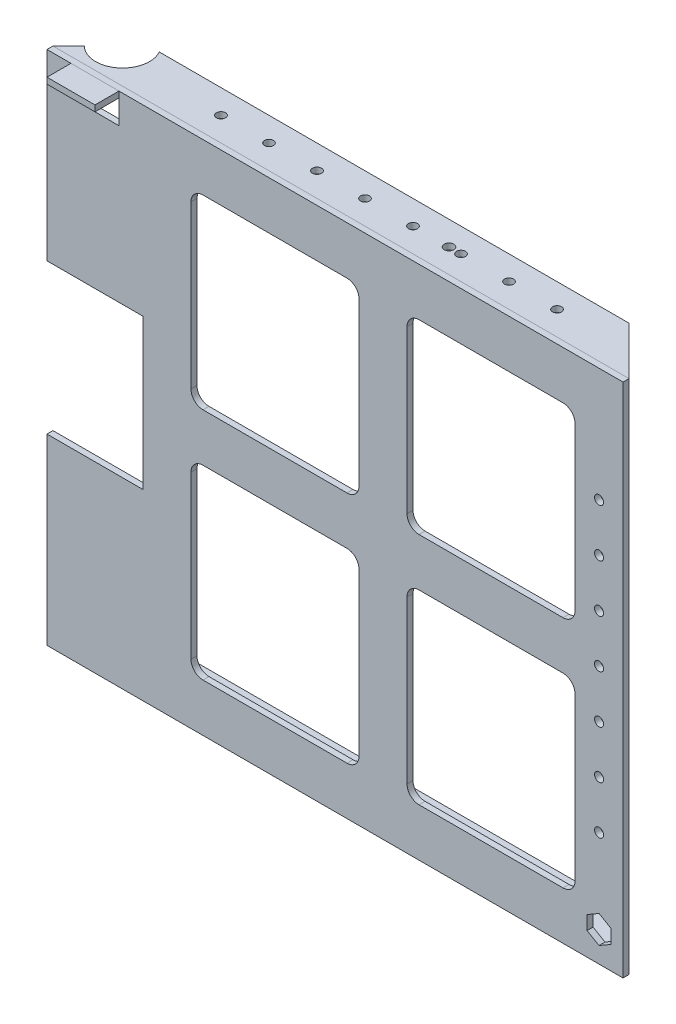
from build123d import *

# Parameters (mm, degrees)
SKETCH1_W           = 304.8
SKETCH1_H           = 273.05
BOSS_EXTRUDE1_DEPTH = 3.175
SKETCH2_W           = 50.8
SKETCH2_H           = 79.375
CUT_EXTRUDE1_DEPTH  = 3.175
SKETCH4_W           = 304.8
SKETCH4_H           = 3.175
BASE_FLANGE1_DEPTH  = 25.4
SKETCH9_W           = 304.8
SKETCH9_H           = 3.175
BASE_FLANGE2_DEPTH  = 25.4
SKETCH12_W          = 25.4
SKETCH12_H          = 3.175
BASE_FLANGE3_DEPTH  = 12.7
CHAMFER1_SIZE       = 25.4
CHAMFER2_SIZE       = 25.4
SKETCH16_W          = 25.4
SKETCH16_H          = 12.7
CUT_EXTRUDE4_DEPTH  = 3.175
SKETCH17_R          = 2.38125
CUT_EXTRUDE5_DEPTH  = 411.005490817
SKETCH18_R          = 2.38125
CUT_EXTRUDE6_DEPTH  = 411.214423351
SKETCH19_R          = 14.2875
CUT_EXTRUDE7_DEPTH  = 3.175
SKETCH20_R          = 14.2875
CUT_EXTRUDE8_DEPTH  = 3.175
SKETCH21_R          = 2.5527
CUT_EXTRUDE9_DEPTH  = 411.005490817
CUT_EXTRUDE10_DEPTH = 411.214423351


# Sheet-metal steps are written as plain solids
with BuildPart() as part:
    # Sketch1 → Boss-Extrude1 (new body)
    with BuildSketch(Plane.XY):
        with Locations((152.4, 136.525)):
            Rectangle(SKETCH1_W, SKETCH1_H)
    extrude(amount=BOSS_EXTRUDE1_DEPTH)

    # Sketch2 → Cut-Extrude1 (cut)
    with BuildSketch(Plane.XY.offset(3.175)):
        with Locations((25.4, 136.525)):
            Rectangle(SKETCH2_W, SKETCH2_H)
        with BuildLine():
            Line((82.55, 247.65), (158.75, 247.65))
            ThreePointArc((158.75, 247.65), (163.240128061, 245.790128061), (165.1, 241.3))
            Line((165.1, 241.3), (165.1, 155.575))
            ThreePointArc((165.1, 155.575), (163.240128061, 151.084871939), (158.75, 149.225))
            Line((158.75, 149.225), (82.55, 149.225))
            ThreePointArc((82.55, 149.225), (78.059871939, 151.084871939), (76.2, 155.575))
            Line((76.2, 155.575), (76.2, 241.3))
            ThreePointArc((76.2, 241.3), (78.059871939, 245.790128061), (82.55, 247.65))
        make_face()
        with BuildLine():
            Line((279.4, 241.3), (279.4, 155.575))
            ThreePointArc((279.4, 155.575), (277.540128061, 151.084871939), (273.05, 149.225))
            Line((273.05, 149.225), (196.85, 149.225))
            ThreePointArc((196.85, 149.225), (192.359871939, 151.084871939), (190.5, 155.575))
            Line((190.5, 155.575), (190.5, 241.3))
            ThreePointArc((190.5, 241.3), (192.359871939, 245.790128061), (196.85, 247.65))
            Line((196.85, 247.65), (273.05, 247.65))
            ThreePointArc((273.05, 247.65), (277.540128061, 245.790128061), (279.4, 241.3))
        make_face()
        with BuildLine():
            Line((82.55, 123.825), (158.75, 123.825))
            ThreePointArc((158.75, 123.825), (163.240128061, 121.965128061), (165.1, 117.475))
            Line((165.1, 117.475), (165.1, 31.75))
            ThreePointArc((165.1, 31.75), (163.240128061, 27.259871939), (158.75, 25.4))
            Line((158.75, 25.4), (82.55, 25.4))
            ThreePointArc((82.55, 25.4), (78.059871939, 27.259871939), (76.2, 31.75))
            Line((76.2, 31.75), (76.2, 117.475))
            ThreePointArc((76.2, 117.475), (78.059871939, 121.965128061), (82.55, 123.825))
        make_face()
        with BuildLine():
            Line((279.4, 117.475), (279.4, 31.75))
            ThreePointArc((279.4, 31.75), (277.540128061, 27.259871939), (273.05, 25.4))
            Line((273.05, 25.4), (196.85, 25.4))
            ThreePointArc((196.85, 25.4), (192.359871939, 27.259871939), (190.5, 31.75))
            Line((190.5, 31.75), (190.5, 117.475))
            ThreePointArc((190.5, 117.475), (192.359871939, 121.965128061), (196.85, 123.825))
            Line((196.85, 123.825), (273.05, 123.825))
            ThreePointArc((273.05, 123.825), (277.540128061, 121.965128061), (279.4, 117.475))
        make_face()
    extrude(amount=-CUT_EXTRUDE1_DEPTH, mode=Mode.SUBTRACT)

    # Sketch16 → Cut-Extrude4 (cut)
    with BuildSketch(Plane.XY.offset(3.175)):
        with Locations((25.4, 263.525)):
            Rectangle(SKETCH16_W, SKETCH16_H)
    extrude(amount=-CUT_EXTRUDE4_DEPTH, mode=Mode.SUBTRACT)

    # Sketch18 → Cut-Extrude6 (cut, through all)
    with BuildSketch(Plane.XY.offset(3.175)):
        with Locations((292.1, 136.525)):
            Circle(SKETCH18_R)
        with Locations((292.1, 161.925)):
            Circle(SKETCH18_R)
        with Locations((292.1, 111.125)):
            Circle(SKETCH18_R)
        with Locations((292.1, 85.725)):
            Circle(SKETCH18_R)
        with Locations((292.1, 60.325)):
            Circle(SKETCH18_R)
        with Locations((292.1, 187.325)):
            Circle(SKETCH18_R)
        with Locations((292.1, 212.725)):
            Circle(SKETCH18_R)
    extrude(amount=-CUT_EXTRUDE6_DEPTH, mode=Mode.SUBTRACT)

    # Sketch22 → Cut-Extrude10 (cut, through all)
    with BuildSketch(Plane.XY.offset(3.175)):
        Polygon((292.1, 23.207348419), (285.75, 19.541174209), (285.75, 12.208825791), (292.1, 8.542651581), (298.45, 12.208825791), (298.45, 19.541174209), align=None)
    extrude(amount=-CUT_EXTRUDE10_DEPTH, mode=Mode.SUBTRACT)


with BuildPart() as body_2:
    # Sketch4 → Base-Flange1 (new body)
    with BuildSketch(Plane(origin=(0, 0, 0), x_dir=(-1, 0, 0), z_dir=(0, 0, -1))):
        with Locations((-152.4, 271.4625)):
            Rectangle(SKETCH4_W, SKETCH4_H)
    extrude(amount=BASE_FLANGE1_DEPTH)

    # Chamfer1
    chamfer1_edges = [body_2.edges().sort_by_distance(p)[0] for p in [
        (304.8, 271.4625, -25.4),
        (0, 271.4625, -25.4),
    ]]
    chamfer(chamfer1_edges, length=CHAMFER1_SIZE - 0.0001)  # a hair under: the kernel refuses the full size


with BuildPart() as body_3:
    # Sketch9 → Base-Flange2 (new body)
    with BuildSketch(Plane(origin=(0, 0, 0), x_dir=(-1, 0, 0), z_dir=(0, 0, -1))):
        with Locations((-152.4, 1.5875)):
            Rectangle(SKETCH9_W, SKETCH9_H)
    extrude(amount=BASE_FLANGE2_DEPTH)

    # Chamfer2
    chamfer2_edges = [body_3.edges().sort_by_distance(p)[0] for p in [
        (0, 1.5875, -25.4),
        (304.8, 1.5875, -25.4),
    ]]
    chamfer(chamfer2_edges, length=CHAMFER2_SIZE - 0.0001)  # a hair under: the kernel refuses the full size


with BuildPart() as body_4:
    # Sketch12 → Base-Flange3 (new body)
    with BuildSketch(Plane.XY.offset(3.175)):
        with Locations((25.4, 271.4625)):
            Rectangle(SKETCH12_W, SKETCH12_H)
    extrude(amount=BASE_FLANGE3_DEPTH)


with BuildPart() as cut_extrude5_tool:
    # Sketch17 → Cut-Extrude5 (new, through all)
    with BuildSketch(Plane(origin=(0, 273.05, 0), x_dir=(1, 0, 0), z_dir=(0, 1, 0))):
        with Locations(Location((76.2, 12.7, 0), (0, 0, 270))):
            Circle(SKETCH17_R)
        with Locations(Location((101.6, 12.7, 0), (0, 0, 270))):
            Circle(SKETCH17_R)
        with Locations(Location((127, 12.7, 0), (0, 0, 270))):
            Circle(SKETCH17_R)
        with Locations(Location((152.4, 12.7, 0), (0, 0, 270))):
            Circle(SKETCH17_R)
        with Locations(Location((177.8, 12.7, 0), (0, 0, 270))):
            Circle(SKETCH17_R)
        with Locations(Location((203.2, 12.7, 0), (0, 0, 270))):
            Circle(SKETCH17_R)
        with Locations(Location((228.6, 12.7, 0), (0, 0, 270))):
            Circle(SKETCH17_R)
        with Locations(Location((254, 12.7, 0), (0, 0, 270))):
            Circle(SKETCH17_R)
    extrude(amount=-CUT_EXTRUDE5_DEPTH)


with BuildPart() as body_2_1:
    add(body_2.part)

    # Cut-Extrude5: cut by cut_extrude5_tool
    add(cut_extrude5_tool.part, mode=Mode.SUBTRACT)

    # Sketch19 → Cut-Extrude7 (cut)
    with BuildSketch(Plane(origin=(0, 273.05, 0), x_dir=(1, 0, 0), z_dir=(0, 1, 0))):
        with Locations((18.415, 18.415)):
            Circle(SKETCH19_R)
    extrude(amount=-CUT_EXTRUDE7_DEPTH, mode=Mode.SUBTRACT)

    # Sketch21 → Cut-Extrude9 (cut, through all)
    with BuildSketch(Plane(origin=(0, 273.05, 0), x_dir=(1, 0, 0), z_dir=(0, 1, 0))):
        with Locations(Location((196.85, 12.7, 0), (0, 0, 270))):
            Circle(SKETCH21_R)
    extrude(amount=-CUT_EXTRUDE9_DEPTH, mode=Mode.SUBTRACT)


with BuildPart() as body_3_1:
    add(body_3.part)

    # Cut-Extrude5: cut by cut_extrude5_tool
    add(cut_extrude5_tool.part, mode=Mode.SUBTRACT)

    # Sketch20 → Cut-Extrude8 (cut)
    with BuildSketch(Plane(origin=(0, 3.175, 0), x_dir=(1, 0, 0), z_dir=(0, 1, 0))):
        with Locations((18.415, 18.415)):
            Circle(SKETCH20_R)
    extrude(amount=-CUT_EXTRUDE8_DEPTH, mode=Mode.SUBTRACT)


solid = Compound([part.part, body_4.part, body_2_1.part, body_3_1.part])
